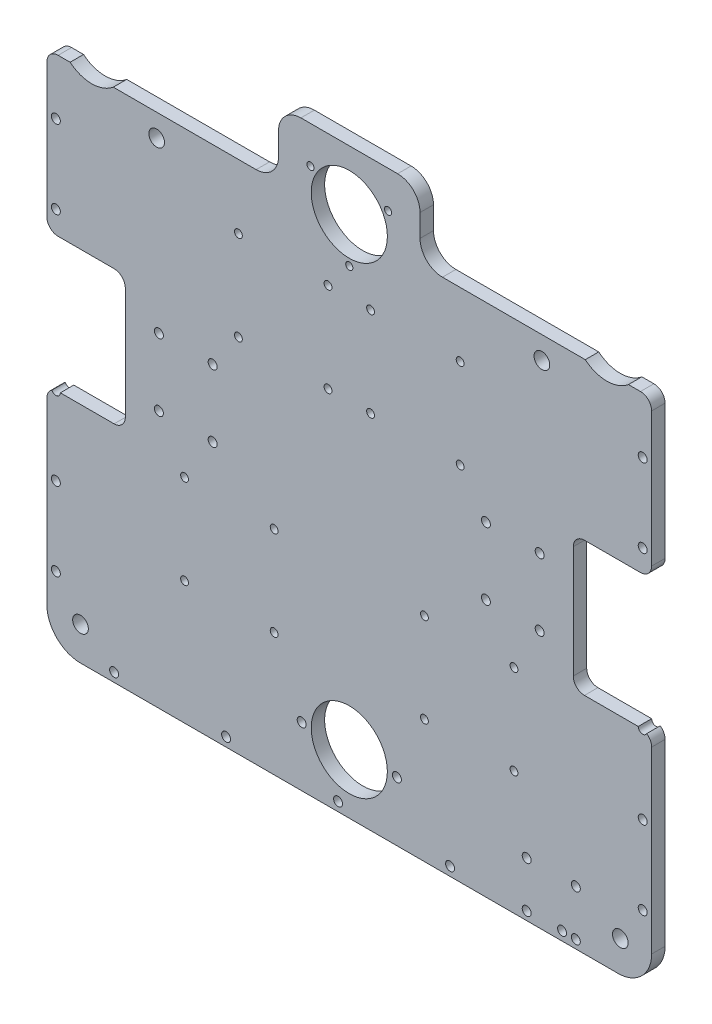
from build123d import *

# Parameters (mm, degrees)
SKETCH1_W            = 270
SKETCH1_H            = 260
BOSS_EXTRUDE1_DEPTH  = 6
SKETCH2_R            = 2
SKETCH2_W            = 35
SKETCH2_H            = 60
CUT_EXTRUDE1_DEPTH   = 188.512666239
SKETCH3_R            = 17
CUT_EXTRUDE2_DEPTH   = 188.512666239
SKETCH4_R            = 2
CUT_EXTRUDE3_DEPTH   = 188.512666239
SKETCH5_R            = 2
CUT_EXTRUDE4_DEPTH   = 188.512666239
FILLET1_R            = 15
SKETCH6_R            = 12.5
CUT_EXTRUDE5_DEPTH   = 188.512666239
SKETCH8_R            = 1.75
CUT_EXTRUDE6_DEPTH   = 188.512666239
SKETCH9_R            = 12.5
CUT_EXTRUDE7_DEPTH   = 188.512666239
SKETCH10_W           = 103.406579867
SKETCH10_H           = 30
CUT_EXTRUDE8_DEPTH   = 188.512666239
FILLET2_R            = 10
FILLET2_OF_MIRROR3_R = 10
SKETCH11_R           = 1.6
SKETCH11_R_2         = 3.5
CUT_EXTRUDE9_DEPTH   = 188.512666239
SKETCH12_R           = 15
CUT_EXTRUDE10_DEPTH  = 188.512666239
FILLET3_R            = 5
FILLET4_R            = 5
SKETCH13_R           = 1.75
SKETCH13_R_2         = 2
CUT_EXTRUDE11_DEPTH  = 188.512666239


with BuildPart() as part:
    # Sketch1 → Boss-Extrude1 (new body)
    with BuildSketch(Plane.XY):
        Rectangle(SKETCH1_W, SKETCH1_H)
    extrude(amount=BOSS_EXTRUDE1_DEPTH)

    # Sketch2 → Cut-Extrude1 (cut, through all)
    with BuildSketch(Plane.XY.offset(6)):
        with Locations((-85, 15)):
            Circle(SKETCH2_R)
        with Locations((-61, 15)):
            Circle(SKETCH2_R)
        with Locations((-61, -15)):
            Circle(SKETCH2_R)
        with Locations((-85, -15)):
            Circle(SKETCH2_R)
        with Locations((-117.5, 0)):
            Rectangle(SKETCH2_W, SKETCH2_H)
    cut_extrude1 = extrude(amount=-CUT_EXTRUDE1_DEPTH, mode=Mode.SUBTRACT)

    # Sketch3 → Cut-Extrude2 (cut, through all)
    with BuildSketch(Plane.XY.offset(6)):
        with Locations((0, -103.5)):
            Circle(SKETCH3_R)
    cut_extrude2 = extrude(amount=-CUT_EXTRUDE2_DEPTH, mode=Mode.SUBTRACT)

    # Mirror1: Cut-Extrude1 across plane
    add(cut_extrude1.mirror(Plane(origin=(0, 0, 0), x_dir=(0, 0, 1), z_dir=(1, 0, 0))), mode=Mode.SUBTRACT)

    # Mirror2: Cut-Extrude2 across plane
    add(cut_extrude2.mirror(Plane.ZX), mode=Mode.SUBTRACT)

    # Sketch4 → Cut-Extrude3 (cut, through all)
    with BuildSketch(Plane.XY.offset(6)):
        with Locations((21.25, -103.5)):
            Circle(SKETCH4_R)
        with Locations((-21.25, -103.5)):
            Circle(SKETCH4_R)
    extrude(amount=-CUT_EXTRUDE3_DEPTH, mode=Mode.SUBTRACT)

    # Sketch5 → Cut-Extrude4 (cut, through all)
    with BuildSketch(Plane.XY.offset(6)):
        with Locations((79.206538854, -126.234773755)):
            Circle(SKETCH5_R)
        with Locations((79.206538854, -105.765226245)):
            Circle(SKETCH5_R)
        with Locations((101.138196901, -105.765226245)):
            Circle(SKETCH5_R)
        with Locations((101.138196901, -126.234773755)):
            Circle(SKETCH5_R)
    extrude(amount=-CUT_EXTRUDE4_DEPTH, mode=Mode.SUBTRACT)

    # Fillet1
    fillet1_edges = [part.edges().sort_by_distance(p)[0] for p in [
        (135, 130, 3),
        (-135, 130, 3),
        (-135, -130, 3),
        (135, -130, 3),
    ]]
    fillet(fillet1_edges, radius=FILLET1_R)

    # Sketch6 → Cut-Extrude5 (cut, through all)
    with BuildSketch(Plane.XY.offset(6)):
        with Locations((-115, 115)):
            Circle(SKETCH6_R)
    extrude(amount=-CUT_EXTRUDE5_DEPTH, mode=Mode.SUBTRACT)

    # Sketch8 → Cut-Extrude6 (cut, through all)
    with BuildSketch(Plane.XY.offset(6)):
        with Locations((49.5, 31.3)):
            Circle(SKETCH8_R)
        with Locations((9.5, 31.3)):
            Circle(SKETCH8_R)
        with Locations((9.5, 71.3)):
            Circle(SKETCH8_R)
        with Locations((49.5, 71.3)):
            Circle(SKETCH8_R)
        with Locations((-49.5, 31.3)):
            Circle(SKETCH8_R)
        with Locations((-9.5, 31.3)):
            Circle(SKETCH8_R)
        with Locations((-49.5, 71.3)):
            Circle(SKETCH8_R)
        with Locations((-9.5, 71.3)):
            Circle(SKETCH8_R)
    extrude(amount=-CUT_EXTRUDE6_DEPTH, mode=Mode.SUBTRACT)

    # Sketch9 → Cut-Extrude7 (cut, through all)
    with BuildSketch(Plane.XY.offset(6)):
        with Locations((115, 111.5)):
            Circle(SKETCH9_R)
    extrude(amount=-CUT_EXTRUDE7_DEPTH, mode=Mode.SUBTRACT)

    # Sketch10 → Cut-Extrude8 (cut, through all)
    with BuildSketch(Plane.XY.offset(6)):
        with Locations((83.296710066, 115)):
            Rectangle(SKETCH10_W, SKETCH10_H)
    cut_extrude8 = extrude(amount=-CUT_EXTRUDE8_DEPTH, mode=Mode.SUBTRACT)

    # Fillet2
    fillet2_edges = [part.edges().sort_by_distance(p)[0] for p in [
        (31.593420133, 130, 3),
        (31.593420133, 100, 3),
    ]]
    fillet(fillet2_edges, radius=FILLET2_R)

    # Mirror3: Cut-Extrude8 across plane
    add(cut_extrude8.mirror(Plane.ZY), mode=Mode.SUBTRACT)

    # Fillet2 of Mirror3
    fillet2_of_mirror3_edges = [part.edges().sort_by_distance(p)[0] for p in [
        (-31.593420133, 130, 3),
        (-31.593420133, 100, 3),
    ]]
    fillet(fillet2_of_mirror3_edges, radius=FILLET2_OF_MIRROR3_R)

    # Sketch11 → Cut-Extrude9 (cut, through all)
    with BuildSketch(Plane.XY.offset(6)):
        with Locations((-17.320508076, 113.5)):
            Circle(SKETCH11_R)
        with Locations((17.320508076, 113.5)):
            Circle(SKETCH11_R)
        with Locations((0, 83.5)):
            Circle(SKETCH11_R)
        with Locations((86, 90)):
            Circle(SKETCH11_R_2)
        with Locations((-86, 90)):
            Circle(SKETCH11_R_2)
        with Locations((121, -116)):
            Circle(SKETCH11_R_2)
        with Locations((-120, -115)):
            Circle(SKETCH11_R_2)
    extrude(amount=-CUT_EXTRUDE9_DEPTH, mode=Mode.SUBTRACT)

    # Sketch12 → Cut-Extrude10 (cut, through all)
    with BuildSketch(Plane.XY.offset(6)):
        with Locations((115, 111.5)):
            Circle(SKETCH12_R)
        with Locations((-115, 111.5)):
            Circle(SKETCH12_R)
    extrude(amount=-CUT_EXTRUDE10_DEPTH, mode=Mode.SUBTRACT)

    # Fillet3
    fillet3_edges = [part.edges().sort_by_distance(p)[0] for p in [
        (135, 100, 3),
        (-135, 100, 3),
    ]]
    fillet(fillet3_edges, radius=FILLET3_R)

    # Fillet4
    fillet4_edges = [part.edges().sort_by_distance(p)[0] for p in [
        (135, 30, 3),
        (100, 30, 3),
        (100, -30, 3),
        (135, -30, 3),
        (-135, -30, 3),
        (-100, -30, 3),
        (-100, 30, 3),
        (-135, 30, 3),
    ]]
    fillet(fillet4_edges, radius=FILLET4_R)

    # Sketch13 → Cut-Extrude11 (cut, through all)
    with BuildSketch(Plane.XY.offset(6)):
        with Locations((33.544641935, -34.940258228)):
            Circle(SKETCH13_R)
        with Locations((73.544641935, -34.940258228)):
            Circle(SKETCH13_R)
        with Locations((73.544641935, -74.940258228)):
            Circle(SKETCH13_R)
        with Locations((33.544641935, -74.940258228)):
            Circle(SKETCH13_R)
        with Locations((-33.544641935, -74.940258228)):
            Circle(SKETCH13_R)
        with Locations((-73.544641935, -74.940258228)):
            Circle(SKETCH13_R)
        with Locations((-73.544641935, -34.940258228)):
            Circle(SKETCH13_R)
        with Locations((-33.544641935, -34.940258228)):
            Circle(SKETCH13_R)
        with Locations((-131, -100)):
            Circle(SKETCH13_R_2)
        with Locations((-131, -65)):
            Circle(SKETCH13_R_2)
        with Locations((-131, -30)):
            Circle(SKETCH13_R_2)
        with Locations((-131, 5)):
            Circle(SKETCH13_R_2)
        with Locations((-131, 40)):
            Circle(SKETCH13_R_2)
        with Locations((-131, 75)):
            Circle(SKETCH13_R_2)
        with Locations((-105, -126)):
            Circle(SKETCH13_R_2)
        with Locations((-55, -126)):
            Circle(SKETCH13_R_2)
        with Locations((-5, -126)):
            Circle(SKETCH13_R_2)
        with Locations((45, -126)):
            Circle(SKETCH13_R_2)
        with Locations((95, -126)):
            Circle(SKETCH13_R_2)
        with Locations((145, -126)):
            Circle(SKETCH13_R_2)
        with Locations((195, -126)):
            Circle(SKETCH13_R_2)
        with Locations((245, -126)):
            Circle(SKETCH13_R_2)
        with Locations((295, -126)):
            Circle(SKETCH13_R_2)
        with Locations((345, -126)):
            Circle(SKETCH13_R_2)
        with Locations((395, -126)):
            Circle(SKETCH13_R_2)
        with Locations((445, -126)):
            Circle(SKETCH13_R_2)
        with Locations((495, -126)):
            Circle(SKETCH13_R_2)
        with Locations((131, 75)):
            Circle(SKETCH13_R_2)
        with Locations((131, 40)):
            Circle(SKETCH13_R_2)
        with Locations((131, 5)):
            Circle(SKETCH13_R_2)
        with Locations((131, -30)):
            Circle(SKETCH13_R_2)
        with Locations((131, -65)):
            Circle(SKETCH13_R_2)
        with Locations((131, -100)):
            Circle(SKETCH13_R_2)
    extrude(amount=-CUT_EXTRUDE11_DEPTH, mode=Mode.SUBTRACT)


solid = part.part
